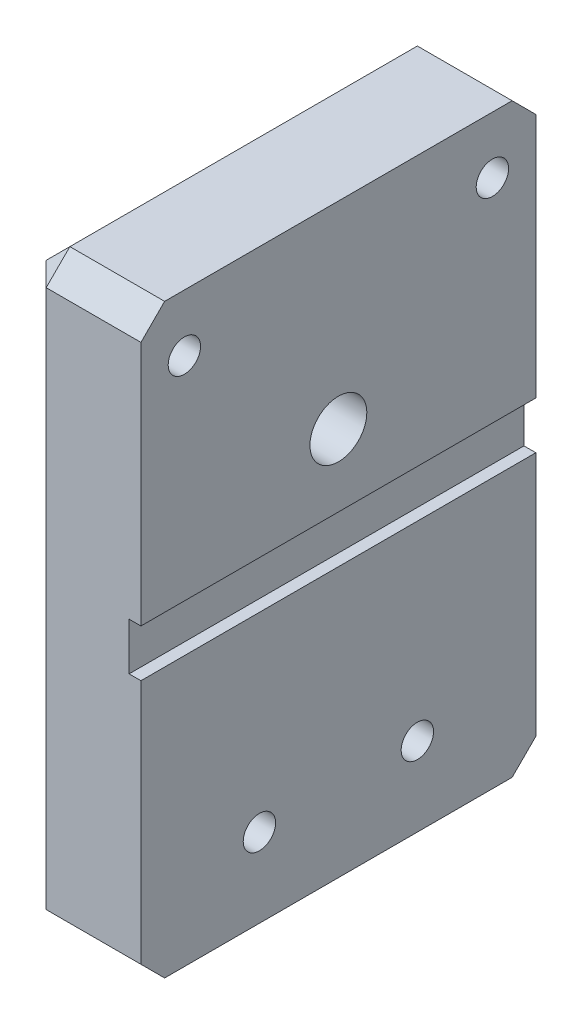
from build123d import *

# Parameters (mm, degrees)
SKETCH1_W           = 15
SKETCH1_H           = 74.2
BOSS_EXTRUDE1_DEPTH = 50
SKETCH4_R           = 2.5
CUT_EXTRUDE4_DEPTH  = 4
CHAMFER2_SIZE       = 0.8
SKETCH5_R           = 3.6
CUT_EXTRUDE5_DEPTH  = 15
CHAMFER3_SIZE       = 1.5
SKETCH6_W           = 1.5
SKETCH6_H           = 6
CUT_EXTRUDE6_DEPTH  = 50
SKETCH7_R           = 3.75
CUT_EXTRUDE7_DEPTH  = 5
SKETCH8_R           = 2.05
CUT_EXTRUDE8_DEPTH  = 10


with BuildPart() as part:
    # Sketch1 → Boss-Extrude1 (new body)
    with BuildSketch(Plane.XY):
        with Locations((-7.5, -37.1)):
            Rectangle(SKETCH1_W, SKETCH1_H)
    extrude(amount=BOSS_EXTRUDE1_DEPTH)

    # Sketch4 → Cut-Extrude4 (cut)
    with BuildSketch(Plane.ZY.offset(15)):
        with Locations(Location((43, -25, 0), (0, 0, 270))):
            Circle(SKETCH4_R)
        with Locations(Location((41.217439622, -32.809907304, 0), (0, 0, 270))):
            Circle(SKETCH4_R)
        with Locations(Location((36.222816433, -39.072966684, 0), (0, 0, 270))):
            Circle(SKETCH4_R)
        with Locations(Location((29.005376811, -42.548702419, 0), (0, 0, 270))):
            Circle(SKETCH4_R)
        with Locations(Location((20.994623189, -42.548702419, 0), (0, 0, 270))):
            Circle(SKETCH4_R)
        with Locations(Location((13.777183567, -39.072966684, 0), (0, 0, 270))):
            Circle(SKETCH4_R)
        with Locations(Location((8.782560378, -32.809907304, 0), (0, 0, 270))):
            Circle(SKETCH4_R)
        with Locations(Location((7, -25, 0), (0, 0, 270))):
            Circle(SKETCH4_R)
        with Locations(Location((8.782560378, -17.190092696, 0), (0, 0, 270))):
            Circle(SKETCH4_R)
        with Locations(Location((13.777183567, -10.927033316, 0), (0, 0, 270))):
            Circle(SKETCH4_R)
        with Locations(Location((20.994623189, -7.451297581, 0), (0, 0, 270))):
            Circle(SKETCH4_R)
        with Locations(Location((29.005376811, -7.451297581, 0), (0, 0, 270))):
            Circle(SKETCH4_R)
        with Locations(Location((36.222816433, -10.927033316, 0), (0, 0, 270))):
            Circle(SKETCH4_R)
        with Locations(Location((41.217439622, -17.190092696, 0), (0, 0, 270))):
            Circle(SKETCH4_R)
    extrude(amount=-CUT_EXTRUDE4_DEPTH, mode=Mode.SUBTRACT)

    # Chamfer2
    chamfer2_edges = [part.edges().sort_by_distance(p)[0] for p in [
        (-15, -30.309907304, 41.217439622),
        (-15, -36.572966684, 36.222816433),
        (-15, -40.048702419, 29.005376811),
        (-15, -40.048702419, 20.994623189),
        (-15, -36.572966684, 13.777183567),
        (-15, -30.309907304, 8.782560378),
        (-15, -22.5, 7),
        (-15, -14.690092696, 8.782560378),
        (-15, -8.427033316, 13.777183567),
        (-15, -4.951297581, 20.994623189),
        (-15, -4.951297581, 29.005376811),
        (-15, -8.427033316, 36.222816433),
        (-15, -14.690092696, 41.217439622),
        (-15, -22.5, 43),
    ]]
    chamfer(chamfer2_edges, length=CHAMFER2_SIZE)

    # Sketch5 → Cut-Extrude5 (cut)
    with BuildSketch(Plane.ZY.offset(15)):
        with Locations(Location((25, -25, 0), (0, 0, 270))):
            Circle(SKETCH5_R)
    extrude(amount=-CUT_EXTRUDE5_DEPTH, mode=Mode.SUBTRACT)

    # Chamfer3
    chamfer3_edges = [part.edges().sort_by_distance(p)[0] for p in [
        (-15, -21.4, 25),
    ]]
    chamfer(chamfer3_edges, length=CHAMFER3_SIZE)

    # Sketch6 → Cut-Extrude6 (cut)
    with BuildSketch(Plane.XY.offset(50)):
        with Locations((-0.75, -37.1)):
            Rectangle(SKETCH6_W, SKETCH6_H)
    extrude(amount=-CUT_EXTRUDE6_DEPTH, mode=Mode.SUBTRACT)

    # Sketch7 → Cut-Extrude7 (cut)
    with BuildSketch(Plane.ZY.offset(15)):
        with Locations((15, -64.2)):
            Circle(SKETCH7_R)
        with Locations((35, -64.2)):
            Circle(SKETCH7_R)
        with Locations((5.5, -7.2)):
            Circle(SKETCH7_R)
        with Locations((44.5, -7.2)):
            Circle(SKETCH7_R)
    extrude(amount=-CUT_EXTRUDE7_DEPTH, mode=Mode.SUBTRACT)

    # Sketch8 → Cut-Extrude8 (cut)
    with BuildSketch(Plane.ZY.offset(10)):
        with Locations((35, -64.2)):
            Circle(SKETCH8_R)
        with Locations((15, -64.2)):
            Circle(SKETCH8_R)
        with Locations((5.5, -7.2)):
            Circle(SKETCH8_R)
        with Locations((44.5, -7.2)):
            Circle(SKETCH8_R)
    extrude(amount=-CUT_EXTRUDE8_DEPTH, mode=Mode.SUBTRACT)

    # Chamfer4
    # the kernel refuses this chamfer: 3 mm, written as the material it takes off along each edge
    with BuildSketch(Plane(origin=(-13, -72.2, 48), x_dir=(0.7071067811865476, -0.7071067811865476, 0), z_dir=(-0.5773502691896257, -0.5773502691896257, 0.5773502691896257)), Plane(origin=(-13, -2, 48), x_dir=(0.7071067811865476, 0, 0.7071067811865476), z_dir=(-0.5773502691896257, 0.5773502691896257, 0.5773502691896257))) as chamfer4_piece_1:
        Polygon((-2.121320344, -1.224744871), (2.121320344, -1.224744871), (0, 2.449489743), align=None)
    extrude(amount=3.810511777, mode=Mode.SUBTRACT)
    with BuildSketch(Plane(origin=(-13, -72.2, 2), x_dir=(0.7071067811865476, -0.7071067811865476, 0), z_dir=(-0.5773502691896257, -0.5773502691896257, -0.5773502691896257)), Plane(origin=(-13, -2, 2), x_dir=(0.7071067811865476, 0, -0.7071067811865476), z_dir=(-0.5773502691896257, 0.5773502691896257, -0.5773502691896257))) as chamfer4_piece_2:
        Polygon((-2.121320344, 1.224744871), (2.121320344, 1.224744871), (0, -2.449489743), align=None)
    extrude(amount=3.810511777, mode=Mode.SUBTRACT)
    with BuildSketch(Plane(origin=(7.715048964, -74.2, 50), x_dir=(0, -0.027495876610586768, -0.9996219169112968), z_dir=(-1, 0, 0)), Plane(origin=(-22.715048964, 0, 0), x_dir=(0, -0.9996219169112968, -0.027495876610586372), z_dir=(1, 0, 0))) as chamfer4_piece_3:
        with BuildLine():
            Line((3.086019586, 0), (-0.169641465, -3.081353381))
            Line((-0.169641465, -3.081353381), (-0.22961878, -3.079703628))
            ThreePointArc((-0.22961878, -3.079703628), (-0.102387681, -1.540193489), (-0.059977315, 0.001649753))
            Line((-0.059977315, 0.001649753), (0.001649753, 0.059977315))
            ThreePointArc((0.001649753, 0.059977315), (1.543492994, 0.017566949), (3.087669338, 0.059977315))
            Line((3.087669338, 0.059977315), (3.086019586, 0))
        make_face()
    extrude(amount=30.430097928, mode=Mode.SUBTRACT)
    with BuildSketch(Plane(origin=(-22.715048964, 0, 50), x_dir=(0, -0.9996219169112968, 0.027495876610586778), z_dir=(1, 0, 0)), Plane(origin=(7.715048964, -74.2, 0), x_dir=(0, -0.027495876610586778, 0.9996219169112968), z_dir=(-1, 0, 0))) as chamfer4_piece_4:
        with BuildLine():
            Line((3.086019586, 0), (-0.169641465, 3.081353381))
            Line((-0.169641465, 3.081353381), (-0.22961878, 3.079703628))
            ThreePointArc((-0.22961878, 3.079703628), (-0.102387681, 1.540193489), (-0.059977315, -0.001649753))
            Line((-0.059977315, -0.001649753), (0.001649753, -0.059977315))
            ThreePointArc((0.001649753, -0.059977315), (1.543492994, -0.017566949), (3.087669338, -0.059977315))
            Line((3.087669338, -0.059977315), (3.086019586, 0))
        make_face()
    extrude(amount=30.430097928, mode=Mode.SUBTRACT)
    with BuildSketch(Plane(origin=(-15, -81.915048964, 0), x_dir=(-0.027495876610586202, 0, 0.9996219169112968), z_dir=(0, 1, 0))) as chamfer4_piece_5:
        with BuildLine():
            Line((3.086019586, 0), (-0.169641465, 3.081353381))
            Line((-0.169641465, 3.081353381), (-0.22961878, 3.079703628))
            ThreePointArc((-0.22961878, 3.079703628), (-0.102387681, 1.540193489), (-0.059977315, -0.001649753))
            Line((-0.059977315, -0.001649753), (0.001649753, -0.059977315))
            ThreePointArc((0.001649753, -0.059977315), (1.543492994, -0.017566949), (3.087669338, -0.059977315))
            Line((3.087669338, -0.059977315), (3.086019586, 0))
        make_face()
    extrude(amount=89.630097928, mode=Mode.SUBTRACT)
    with BuildSketch(Plane(origin=(-15, -74.2, -7.715048964), x_dir=(-0.02749587661058619, 0.9996219169112968, 0), z_dir=(0, 0, 1))) as chamfer4_piece_6:
        with BuildLine():
            Line((3.086019586, 0), (-0.169641465, -3.081353381))
            Line((-0.169641465, -3.081353381), (-0.22961878, -3.079703628))
            ThreePointArc((-0.22961878, -3.079703628), (-0.102387681, -1.540193489), (-0.059977315, 0.001649753))
            Line((-0.059977315, 0.001649753), (0.001649753, 0.059977315))
            ThreePointArc((0.001649753, 0.059977315), (1.543492994, 0.017566949), (3.087669338, 0.059977315))
            Line((3.087669338, 0.059977315), (3.086019586, 0))
        make_face()
    extrude(amount=65.430097928, mode=Mode.SUBTRACT)
    with BuildSketch(Plane(origin=(-15, 0, -7.715048964), x_dir=(-0.027495876610586202, -0.9996219169112968, 0), z_dir=(0, 0, 1))) as chamfer4_piece_7:
        with BuildLine():
            Line((3.086019586, 0), (-0.169641465, 3.081353381))
            Line((-0.169641465, 3.081353381), (-0.22961878, 3.079703628))
            ThreePointArc((-0.22961878, 3.079703628), (-0.102387681, 1.540193489), (-0.059977315, -0.001649753))
            Line((-0.059977315, -0.001649753), (0.001649753, -0.059977315))
            ThreePointArc((0.001649753, -0.059977315), (1.543492994, -0.017566949), (3.087669338, -0.059977315))
            Line((3.087669338, -0.059977315), (3.086019586, 0))
        make_face()
    extrude(amount=65.430097928, mode=Mode.SUBTRACT)
    with BuildSketch(Plane(origin=(-15, -81.915048964, 50), x_dir=(-0.02749587661058619, 0, -0.9996219169112968), z_dir=(0, 1, 0))) as chamfer4_piece_8:
        with BuildLine():
            Line((3.086019586, 0), (-0.169641465, -3.081353381))
            Line((-0.169641465, -3.081353381), (-0.22961878, -3.079703628))
            ThreePointArc((-0.22961878, -3.079703628), (-0.102387681, -1.540193489), (-0.059977315, 0.001649753))
            Line((-0.059977315, 0.001649753), (0.001649753, 0.059977315))
            ThreePointArc((0.001649753, 0.059977315), (1.543492994, 0.017566949), (3.087669338, 0.059977315))
            Line((3.087669338, 0.059977315), (3.086019586, 0))
        make_face()
    extrude(amount=89.630097928, mode=Mode.SUBTRACT)


solid = part.part
